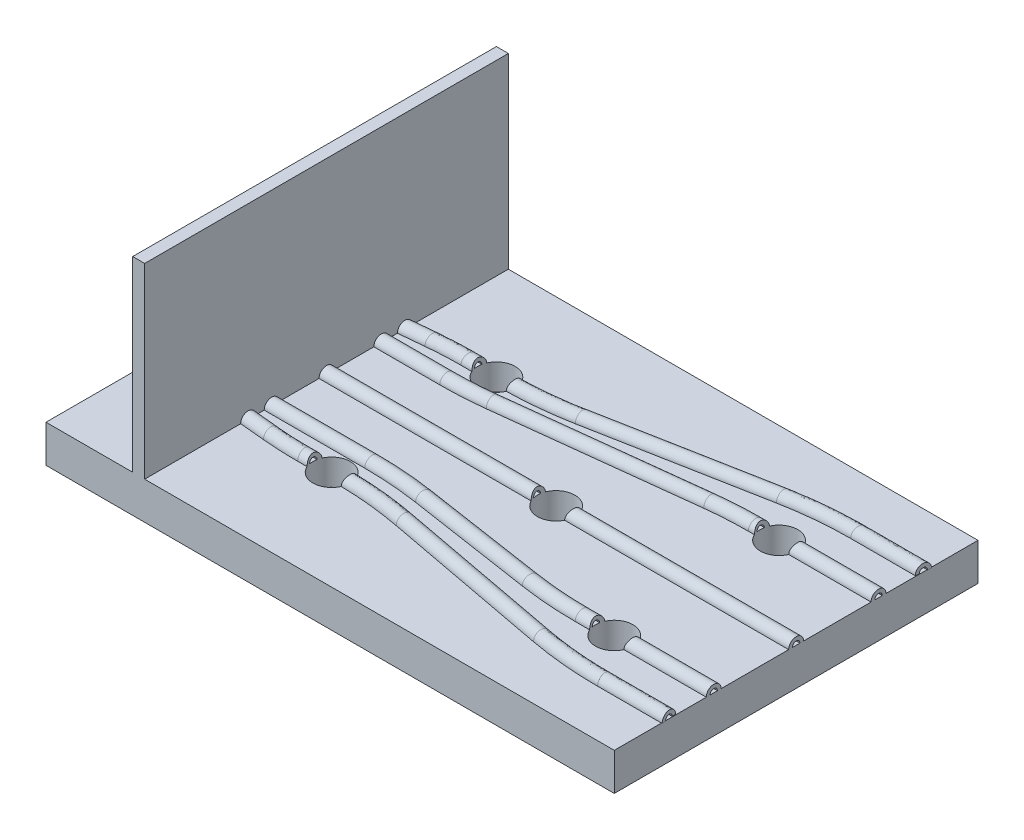
from build123d import *

# Parameters (mm, degrees)
SKETCH1_W               = 76.04
SKETCH1_H               = 48.67
BOSS_EXTRUDE1_DEPTH     = 5
SKETCH2_R               = 2.5
CUT_EXTRUDE1_DEPTH      = 3.5
SKETCH3_W               = 1.6
SKETCH3_H               = 48.67
BOSS_EXTRUDE2_DEPTH     = 25
SKETCH4_R               = 1
SKETCH4_R_2             = 0.5
SKETCH6_R               = 1
SKETCH6_R_2             = 0.5
SKETCH8_R               = 1
SKETCH8_R_2             = 0.5
SKETCH10_R              = 1
SKETCH10_R_2            = 0.5
SKETCH12_R              = 1
SKETCH12_R_2            = 0.5
CUT_EXTRUDE2_DEPTH      = 3
CUT_EXTRUDE2_DEPTH_BACK = 3
SKETCH14_R              = 2.5
SKETCH15_W              = 2.661161515
SKETCH15_H              = 48.593602324
CUT_EXTRUDE3_DEPTH      = 13


with BuildPart() as part:
    # Sketch1 → Boss-Extrude1 (new body)
    with BuildSketch(Plane(origin=(0, 0, 0), x_dir=(1, 0, 0), z_dir=(0, 1, 0))):
        with Locations((-4.91491945, 2.376855481)):
            Rectangle(SKETCH1_W, SKETCH1_H)
    extrude(amount=BOSS_EXTRUDE1_DEPTH)

    # Sketch2 → Cut-Extrude1 (cut)
    with BuildSketch(Plane(origin=(0, 5, 0), x_dir=(1, 0, 0), z_dir=(0, 1, 0))):
        with Locations(Location((19.79508055, 13.401855481, 0), (0, 0, 270))):
            Circle(SKETCH2_R)
        with Locations(Location((19.79508055, -8.648144519, 0), (0, 0, 270))):
            Circle(SKETCH2_R)
        with Locations(Location((0.88508055, 2.481855481, 0), (0, 0, 270))):
            Circle(SKETCH2_R)
        with Locations(Location((-18.02491945, 13.401855481, 0), (0, 0, 270))):
            Circle(SKETCH2_R)
        with Locations(Location((-18.02491945, -8.648144519, 0), (0, 0, 270))):
            Circle(SKETCH2_R)
    extrude(amount=-CUT_EXTRUDE1_DEPTH, mode=Mode.SUBTRACT)

    # Sketch3 → Boss-Extrude2 (add)
    with BuildSketch(Plane(origin=(0, 5, 0), x_dir=(1, 0, 0), z_dir=(0, 1, 0))):
        with Locations((-30.53491945, 2.376855481)):
            Rectangle(SKETCH3_W, SKETCH3_H)
    extrude(amount=BOSS_EXTRUDE2_DEPTH)

    # Sweep5: sweep along a path in Sketch5
    with BuildLine(Plane(origin=(0, 5, 0), x_dir=(1, 0, 0), z_dir=(0, 1, 0))) as sweep5_path:
        Line((-31.33491945, -4.958144519), (-16.287342767, -4.958144519))
        ThreePointArc((-16.287342767, -4.958144519), (-12.524788922, -5.099913618), (-8.783571632, -5.524416976))
        Line((-8.783571632, -5.524416976), (8.064561871, -8.081872061))
        ThreePointArc((8.064561871, -8.081872061), (11.805779162, -8.50637542), (15.568333007, -8.648144519))
        Line((15.568333007, -8.648144519), (19.79508055, -8.648144519))
        Line((19.79508055, -8.648144519), (33.10508055, -8.648144519))
    # Sketch4 → Sweep5 (sweep)
    with BuildSketch(Plane.ZY.offset(31.33491945)):
        with Locations((4.958144519, 5)):
            Circle(SKETCH4_R)
        with Locations((4.958144519, 5)):
            Circle(SKETCH4_R_2, mode=Mode.SUBTRACT)
    sweep(path=sweep5_path.line)

    # Sweep6: sweep along a path in Sketch7
    with BuildLine(Plane(origin=(0, 5, 0), x_dir=(1, 0, 0), z_dir=(0, 1, 0))) as sweep6_path:
        Line((-31.33491945, -7.958144519), (-26.369048026, -8.426879304))
        ThreePointArc((-26.369048026, -8.426879304), (-24.02231311, -8.592797582), (-21.670371282, -8.648144519))
        Line((-21.670371282, -8.648144519), (-18.02491945, -8.648144519))
        Line((-18.02491945, -8.648144519), (-16.697762699, -8.648144519))
        ThreePointArc((-16.697762699, -8.648144519), (-12.045193479, -8.865079129), (-7.432996391, -9.514000533))
        Line((-7.432996391, -9.514000533), (15.20315749, -13.782288505))
        ThreePointArc((15.20315749, -13.782288505), (19.815354578, -14.431209909), (24.467923798, -14.648144519))
        Line((24.467923798, -14.648144519), (33.10508055, -14.648144519))
    # Sketch6 → Sweep6 (sweep)
    with BuildSketch(Plane.ZY.offset(31.33491945)):
        with Locations((7.958144519, 5)):
            Circle(SKETCH6_R)
        with Locations((7.958144519, 5)):
            Circle(SKETCH6_R_2, mode=Mode.SUBTRACT)
    sweep(path=sweep6_path.line)

    # Sweep7: sweep along a path in Sketch9
    with BuildLine(Plane(origin=(0, 5, 0), x_dir=(1, 0, 0), z_dir=(0, 1, 0))) as sweep7_path:
        Line((-31.33491945, 12.711855481), (-26.369048026, 13.180590267))
        ThreePointArc((-26.369048026, 13.180590267), (-24.02231311, 13.346508545), (-21.670371282, 13.401855481))
        Line((-21.670371282, 13.401855481), (-18.02491945, 13.401855481))
        Line((-18.02491945, 13.401855481), (-16.697762699, 13.401855481))
        ThreePointArc((-16.697762699, 13.401855481), (-12.045193479, 13.618790091), (-7.432996391, 14.267711495))
        Line((-7.432996391, 14.267711495), (15.20315749, 18.535999467))
        ThreePointArc((15.20315749, 18.535999467), (19.815354578, 19.184920871), (24.467923798, 19.401855481))
        Line((24.467923798, 19.401855481), (33.10508055, 19.401855481))
    # Sketch8 → Sweep7 (sweep)
    with BuildSketch(Plane.ZY.offset(31.33491945)):
        with Locations((-12.711855481, 5)):
            Circle(SKETCH8_R)
        with Locations((-12.711855481, 5)):
            Circle(SKETCH8_R_2, mode=Mode.SUBTRACT)
    sweep(path=sweep7_path.line)

    # Sweep8: sweep along a path in Sketch11
    with BuildLine(Plane(origin=(0, 5, 0), x_dir=(1, 0, 0), z_dir=(0, 1, 0))) as sweep8_path:
        Line((-31.33491945, 9.711855481), (-20.914357769, 9.711855481))
        ThreePointArc((-20.914357769, 9.711855481), (-18.029732099, 9.795135489), (-15.154715696, 10.044698091))
        Line((-15.154715696, 10.044698091), (10.924876795, 13.069012871))
        ThreePointArc((10.924876795, 13.069012871), (13.799893199, 13.318575473), (16.684518868, 13.401855481))
        Line((16.684518868, 13.401855481), (19.79508055, 13.401855481))
        Line((19.79508055, 13.401855481), (33.10508055, 13.401855481))
    # Sketch10 → Sweep8 (sweep)
    with BuildSketch(Plane.ZY.offset(31.33491945)):
        with Locations((-9.711855481, 5)):
            Circle(SKETCH10_R)
        with Locations((-9.711855481, 5)):
            Circle(SKETCH10_R_2, mode=Mode.SUBTRACT)
    sweep(path=sweep8_path.line)

    # Sweep9: sweep along a path in Sketch13
    with BuildLine(Plane(origin=(0, 5, 0), x_dir=(1, 0, 0), z_dir=(0, 1, 0))) as sweep9_path:
        Line((-31.33491945, 2.376855481), (33.10508055, 2.376855481))
    # Sketch12 → Sweep9 (sweep)
    with BuildSketch(Plane.ZY.offset(31.33491945)):
        with Locations((-2.376855481, 5)):
            Circle(SKETCH12_R)
        with Locations((-2.376855481, 5)):
            Circle(SKETCH12_R_2, mode=Mode.SUBTRACT)
    sweep(path=sweep9_path.line)

    # Sketch14 → Cut-Extrude2 (cut, two sides: drawn at the far end of the back side and taken through both)
    with BuildSketch(Plane(origin=(0, 5, 0), x_dir=(1, 0, 0), z_dir=(0, 1, 0)).offset(-CUT_EXTRUDE2_DEPTH_BACK)):
        with Locations(Location((-18.02491945, -8.648144519, 0), (0, 0, 270))):
            Circle(SKETCH14_R)
        with Locations(Location((0.88508055, 2.481855481, 0), (0, 0, 270))):
            Circle(SKETCH14_R)
        with Locations(Location((19.79508055, -8.648144519, 0), (0, 0, 270))):
            Circle(SKETCH14_R)
        with Locations(Location((19.79508055, 13.401855481, 0), (0, 0, 270))):
            Circle(SKETCH14_R)
        with Locations(Location((-18.02491945, 13.401855481, 0), (0, 0, 270))):
            Circle(SKETCH14_R)
    extrude(amount=CUT_EXTRUDE2_DEPTH + CUT_EXTRUDE2_DEPTH_BACK, mode=Mode.SUBTRACT)

    # Sketch15 → Cut-Extrude3 (cut)
    with BuildSketch(Plane(origin=(0, 5, 0), x_dir=(1, 0, 0), z_dir=(0, 1, 0))):
        with Locations((34.435661307, 2.415054319)):
            Rectangle(SKETCH15_W, SKETCH15_H)
    extrude(amount=-CUT_EXTRUDE3_DEPTH, mode=Mode.SUBTRACT)


solid = part.part
